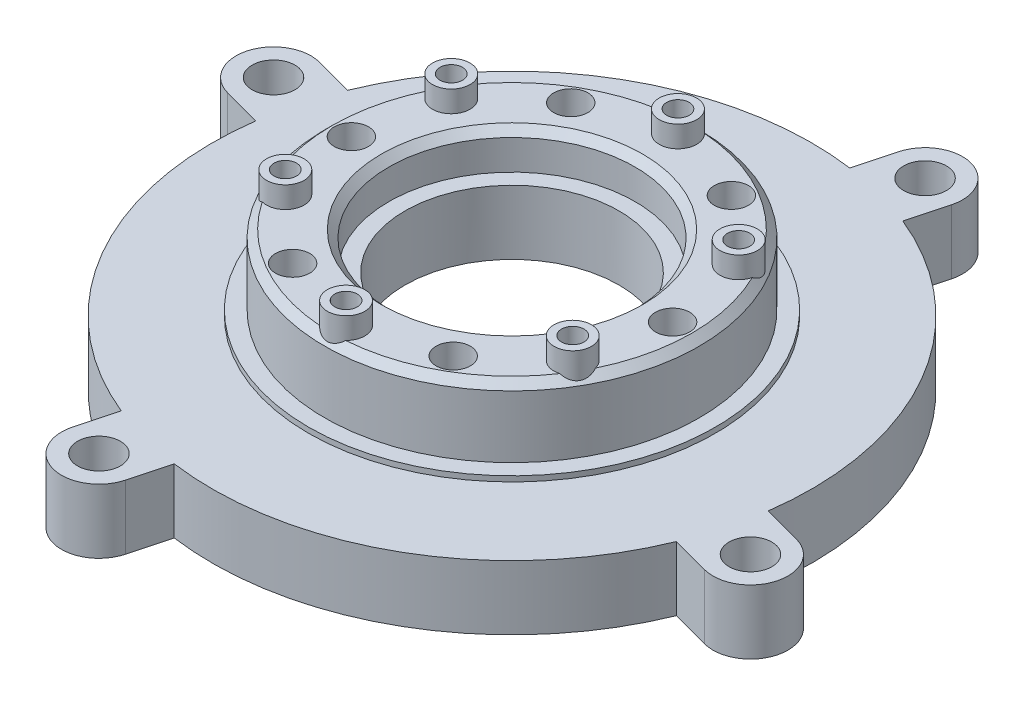
from build123d import *

# Parameters (mm, degrees)
SKETCH1_R           = 28
BOSS_EXTRUDE1_DEPTH = 6
SKETCH2_R           = 19
BOSS_EXTRUDE2_DEPTH = 0.5
SKETCH3_R           = 17.5
BOSS_EXTRUDE3_DEPTH = 6.5
SKETCH4_R           = 1.05
CUT_EXTRUDE1_DEPTH  = 3
CIRPATTERN1_COUNT   = 6
SKETCH5_R           = 11.5
CUT_EXTRUDE2_DEPTH  = 3.5
SKETCH6_R           = 10
CUT_EXTRUDE3_DEPTH  = 9.5
SKETCH7_R           = 1.6
CUT_EXTRUDE4_DEPTH  = 13
CUT_EXTRUDE10_DEPTH = 5
CHAMFER1_SIZE       = 1
SKETCH13_R          = 1.6
BOSS_EXTRUDE4_DEPTH = 6
SKETCH14_R          = 2
CUT_EXTRUDE12_DEPTH = 4
CIRPATTERN3_COUNT   = 4
SKETCH15_R          = 22.5
CUT_EXTRUDE13_DEPTH = 3.5
BOSS_EXTRUDE5_START = 2
SKETCH16_R          = 1.75
SKETCH16_R_2        = 1.05
BOSS_EXTRUDE5_DEPTH = 2
CIRPATTERN4_COUNT   = 6
CHAMFER2_SIZE       = 0.7
CHAMFER3_SIZE       = 0.7
CHAMFER4_SIZE       = 1
CIRPATTERN5_COUNT   = 6


with BuildPart() as part:
    # Sketch1 → Boss-Extrude1 (new body)
    with BuildSketch(Plane(origin=(0, 0, 0), x_dir=(1, 0, 0), z_dir=(0, 1, 0))):
        with Locations(Location((0, 0, 0), (0, 0, 270))):
            Circle(SKETCH1_R)
    extrude(amount=BOSS_EXTRUDE1_DEPTH)

    # Sketch2 → Boss-Extrude2 (add)
    with BuildSketch(Plane(origin=(0, 6, 0), x_dir=(1, 0, 0), z_dir=(0, 1, 0))):
        with Locations(Location((0, 0, 0), (0, 0, 270))):
            Circle(SKETCH2_R)
    extrude(amount=BOSS_EXTRUDE2_DEPTH)

    # Sketch3 → Boss-Extrude3 (add)
    with BuildSketch(Plane(origin=(0, 6.5, 0), x_dir=(1, 0, 0), z_dir=(0, 1, 0))):
        with Locations(Location((0, 0, 0), (0, 0, 90))):
            Circle(SKETCH3_R)
    extrude(amount=BOSS_EXTRUDE3_DEPTH)

    # Sketch4 → Cut-Extrude1 (cut)
    with BuildSketch(Plane(origin=(0, 13, 0), x_dir=(1, 0, 0), z_dir=(0, 1, 0))):
        with Locations(Location((0, 15.5, 0), (0, 0, 270))):
            Circle(SKETCH4_R)
    cut_extrude1 = extrude(amount=-CUT_EXTRUDE1_DEPTH, mode=Mode.SUBTRACT)

    # CirPattern1: Cut-Extrude1 ×6 about axis
    cirpattern1_axis = Axis((0, 0, 0), (0, 1, 0))
    for i in range(1, CIRPATTERN1_COUNT):
        add(cut_extrude1.rotate(cirpattern1_axis, i * 360 / CIRPATTERN1_COUNT), mode=Mode.SUBTRACT)

    # Sketch5 → Cut-Extrude2 (cut)
    with BuildSketch(Plane(origin=(0, 13, 0), x_dir=(1, 0, 0), z_dir=(0, 1, 0))):
        with Locations(Location((0, 0, 0), (0, 0, 270))):
            Circle(SKETCH5_R)
    extrude(amount=-CUT_EXTRUDE2_DEPTH, mode=Mode.SUBTRACT)

    # Sketch6 → Cut-Extrude3 (cut)
    with BuildSketch(Plane(origin=(0, 9.5, 0), x_dir=(1, 0, 0), z_dir=(0, 1, 0))):
        with Locations(Location((0, 0, 0), (0, 0, 270))):
            Circle(SKETCH6_R)
    extrude(amount=-CUT_EXTRUDE3_DEPTH, mode=Mode.SUBTRACT)

    # Sketch7 → Cut-Extrude4 (cut)
    with BuildSketch(Plane(origin=(0, 13, 0), x_dir=(1, 0, 0), z_dir=(0, 1, 0))):
        with Locations(Location((7.5, 12.990381057, 0), (0, 0, 270))):
            Circle(SKETCH7_R)
    cut_extrude4 = extrude(amount=-CUT_EXTRUDE4_DEPTH, mode=Mode.SUBTRACT)

    # Sketch9 → Cut-Extrude10 (cut)
    with BuildSketch(Plane.XZ):
        Polygon((7.5, -9.641749495), (4.6, -11.316065276), (4.6, -14.664696837), (7.5, -16.339012618), (10.4, -14.664696837), (10.4, -11.316065276), align=None)
    cut_extrude10 = extrude(amount=-CUT_EXTRUDE10_DEPTH, mode=Mode.SUBTRACT)

    # Chamfer1
    chamfer1_edges = [part.edges().sort_by_distance(p)[0] for p in [
        (0, 0, -10),
    ]]
    chamfer(chamfer1_edges, length=CHAMFER1_SIZE)

    # Sketch13 → Boss-Extrude4 (add)
    with BuildSketch(Plane(origin=(0, 6, 0), x_dir=(1, 0, 0), z_dir=(0, 1, 0))):
        with BuildLine():
            Line((4.772059529, 31.332530186), (3.027664457, 24.822359149))
            Line((3.027664457, 24.822359149), (9.789145241, 23.010625833))
            Line((9.789145241, 23.010625833), (11.533540313, 29.52079687))
            ThreePointArc((11.533540313, 29.52079687), (9.058666579, 33.80740392), (4.772059529, 31.332530186))
        make_face()
        with Locations(Location((8.152799921, 30.426663528, 0), (0, 0, 270))):
            Circle(SKETCH13_R, mode=Mode.SUBTRACT)
    boss_extrude4 = extrude(amount=-BOSS_EXTRUDE4_DEPTH)

    # Sketch14 → Cut-Extrude12 (cut)
    with BuildSketch(Plane(origin=(0, 6, 0), x_dir=(1, 0, 0), z_dir=(0, 1, 0))):
        with Locations(Location((8.152799921, 30.426663528, 0), (0, 0, 270))):
            Circle(SKETCH14_R)
    cut_extrude12 = extrude(amount=-CUT_EXTRUDE12_DEPTH, mode=Mode.SUBTRACT)

    # CirPattern3: Boss-Extrude4, Cut-Extrude12 ×4 about axis
    cirpattern3_axis = Axis((0, 0, 0), (0, 1, 0))
    add([boss_extrude4.rotate(cirpattern3_axis, i * 360 / CIRPATTERN3_COUNT) for i in range(1, CIRPATTERN3_COUNT)])
    add([cut_extrude12.rotate(cirpattern3_axis, i * 360 / CIRPATTERN3_COUNT) for i in range(1, CIRPATTERN3_COUNT)], mode=Mode.SUBTRACT)

    # Sketch15 → Cut-Extrude13 (cut)
    with BuildSketch(Plane.XZ):
        with Locations(Location((0, 0, 0), (0, 0, 270))):
            Circle(SKETCH15_R)
    extrude(amount=-CUT_EXTRUDE13_DEPTH, mode=Mode.SUBTRACT)

    # Sketch16 → Boss-Extrude5 (add)
    with BuildSketch(Plane(origin=(0, 13, 0), x_dir=(1, 0, 0), z_dir=(0, 1, 0)).offset(BOSS_EXTRUDE5_START)):
        with Locations(Location((0, 15.5, 0), (0, 0, 270))):
            Circle(SKETCH16_R)
        with Locations(Location((0, 15.5, 0), (0, 0, 270))):
            Circle(SKETCH16_R_2, mode=Mode.SUBTRACT)
    boss_extrude5 = extrude(amount=-BOSS_EXTRUDE5_DEPTH)

    # CirPattern4: Boss-Extrude5 ×6 about axis
    cirpattern4_axis = Axis((0, 0, 0), (0, 1, 0))
    for i in range(1, CIRPATTERN4_COUNT):
        add(boss_extrude5.rotate(cirpattern4_axis, i * 360 / CIRPATTERN4_COUNT))

    # Chamfer2
    # the kernel refuses this chamfer: 0.7 mm, written as the material it takes off along each edge
    with BuildSketch(Plane(origin=(0, 13, 0), x_dir=(0, 0, -1), z_dir=(1, 0, 0))) as chamfer2_piece_1_section:
        Polygon((17.5, -CHAMFER2_SIZE), (17.5 - CHAMFER2_SIZE, 0), (17.5, 0), align=None)
    chamfer2_piece_1 = revolve(axis=Axis((0, 13, 0), (0, 1, 0)), mode=Mode.PRIVATE)
    chamfer2_piece_1 = chamfer2_piece_1 - Plane(origin=(-13.423393759, 12.425021075, 7.75), x_dir=(0.8660254037844388, 0, -0.4999999999999996), z_dir=(0, 1, 0)) * Cylinder(1.75, 71, mode=Mode.PRIVATE)
    chamfer2_piece_1 = chamfer2_piece_1 - Plane(origin=(0, 12.425021075, 15.5), x_dir=(0, 0, -1), z_dir=(0, 1, 0)) * Cylinder(1.75, 71, mode=Mode.PRIVATE)
    chamfer2_piece_1 = chamfer2_piece_1 - Plane(origin=(13.423393759, 12.425021075, 7.75), x_dir=(-0.8660254037844384, 0, -0.5000000000000007), z_dir=(0, 1, 0)) * Cylinder(1.75, 71, mode=Mode.PRIVATE)
    chamfer2_piece_1 = chamfer2_piece_1 - Plane(origin=(-13.423393759, 12.425021075, -7.75), x_dir=(0.8660254037844386, 0, 0.5000000000000003), z_dir=(0, 1, 0)) * Cylinder(1.75, 71, mode=Mode.PRIVATE)
    chamfer2_piece_1 = chamfer2_piece_1 - Plane(origin=(0, 12.425021075, -15.5), x_dir=(0, 0, 1), z_dir=(0, 1, 0)) * Cylinder(1.75, 71, mode=Mode.PRIVATE)
    chamfer2_piece_1 = chamfer2_piece_1 - Plane(origin=(13.423393759, 12.425021075, -7.75), x_dir=(-0.8660254037844387, 0, 0.49999999999999994), z_dir=(0, 1, 0)) * Cylinder(1.75, 71, mode=Mode.PRIVATE)
    add(chamfer2_piece_1, mode=Mode.SUBTRACT)

    # Chamfer3
    chamfer3_edges = [part.edges().sort_by_distance(p)[0] for p in [
        (0, 13, -11.5),
    ]]
    chamfer(chamfer3_edges, length=CHAMFER3_SIZE)

    # Chamfer4
    chamfer4_edges = [part.edges().sort_by_distance(p)[0] for p in [
        (0, 0, 22.5),
        (0, 3.5, 22.5),
    ]]
    chamfer(chamfer4_edges, length=CHAMFER4_SIZE)

    # CirPattern5: Cut-Extrude4, Cut-Extrude10 ×6 about axis
    cirpattern5_axis = Axis((0, 0, 0), (0, 1, 0))
    add([cut_extrude4.rotate(cirpattern5_axis, i * 360 / CIRPATTERN5_COUNT) for i in range(1, CIRPATTERN5_COUNT)], mode=Mode.SUBTRACT)
    add([cut_extrude10.rotate(cirpattern5_axis, i * 360 / CIRPATTERN5_COUNT) for i in range(1, CIRPATTERN5_COUNT)], mode=Mode.SUBTRACT)


solid = part.part
